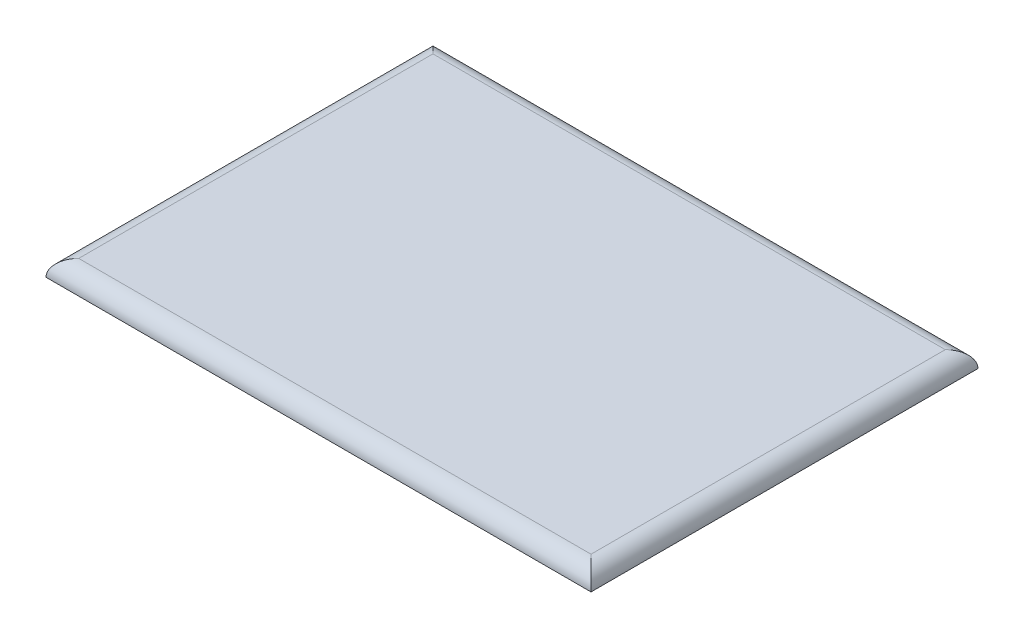
from build123d import *

# Parameters (mm, degrees)
SKETCH1_W           = 100
SKETCH1_H           = 71
BOSS_EXTRUDE1_DEPTH = 3
FILLET4_R           = 3


with BuildPart() as part:
    # Sketch1 → Boss-Extrude1 (new body)
    with BuildSketch(Plane(origin=(0, 0, 0), x_dir=(1, 0, 0), z_dir=(0, 1, 0))):
        with Locations((-4.783432937, 2.318867117)):
            Rectangle(SKETCH1_W, SKETCH1_H)
    extrude(amount=BOSS_EXTRUDE1_DEPTH)

    # Fillet4
    fillet4_edges = [part.edges().sort_by_distance(p)[0] for p in [
        (-4.783432937, 3, -37.818867117),
        (45.216567063, 3, -2.318867117),
        (-4.783432937, 3, 33.181132883),
        (-54.783432937, 3, -2.318867117),
    ]]
    fillet(fillet4_edges, radius=FILLET4_R - 0.0001)  # a hair under: the kernel refuses the full size


solid = part.part
